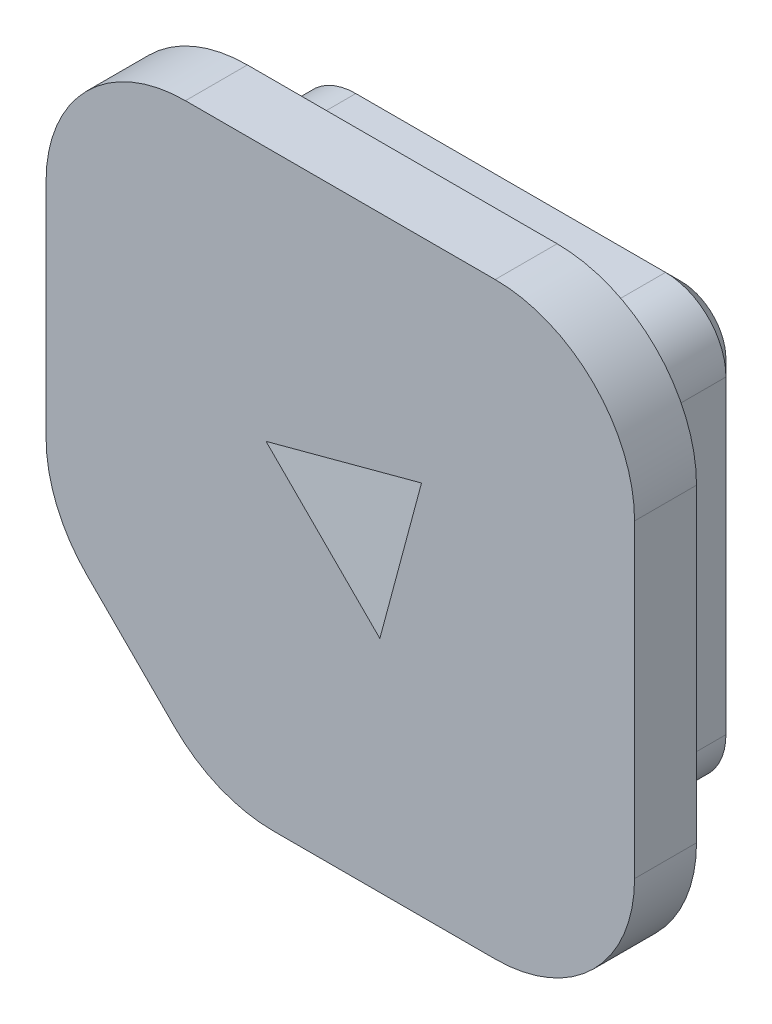
from build123d import *

# Parameters (mm, degrees)
BOSS_EXTRUDE1_DEPTH = 2
BOSS_EXTRUDE2_DEPTH = 4
CUT_EXTRUDE2_DEPTH  = 40.307216504
CHAMFER1_SIZE       = 0.5


with BuildPart() as part:
    # Sketch2 → Boss-Extrude1 (new body)
    with BuildSketch(Plane.XY):
        with BuildLine():
            Line((-26.150665133, -23.322238008), (-23.322238008, -26.150665133))
            ThreePointArc((-23.322238008, -26.150665133), (-21.862332939, -27.126142514), (-20.140257493, -27.468684618))
            Line((-20.140257493, -27.468684618), (-12.968684618, -27.468684618))
            ThreePointArc((-12.968684618, -27.468684618), (-9.786704102, -26.150665133), (-8.468684618, -22.968684618))
            Line((-8.468684618, -22.968684618), (-8.468684618, -12.968684618))
            ThreePointArc((-8.468684618, -12.968684618), (-9.786704102, -9.786704102), (-12.968684618, -8.468684618))
            Line((-12.968684618, -8.468684618), (-22.968684618, -8.468684618))
            ThreePointArc((-22.968684618, -8.468684618), (-26.150665133, -9.786704102), (-27.468684618, -12.968684618))
            Line((-27.468684618, -12.968684618), (-27.468684618, -20.140257493))
            ThreePointArc((-27.468684618, -20.140257493), (-27.126142514, -21.862332939), (-26.150665133, -23.322238008))
        make_face()
    extrude(amount=BOSS_EXTRUDE1_DEPTH)

    # Sketch1 → Boss-Extrude2 (add)
    with BuildSketch(Plane.XY):
        with BuildLine():
            Line((-12.968684618, -11.018684618), (-22.968684618, -11.018684618))
            ThreePointArc((-22.968684618, -11.018684618), (-24.347542841, -11.589826394), (-24.918684618, -12.968684618))
            Line((-24.918684618, -12.968684618), (-24.918684618, -20.140257493))
            ThreePointArc((-24.918684618, -20.140257493), (-24.770249706, -20.886490186), (-24.347542841, -21.519115716))
            Line((-24.347542841, -21.519115716), (-21.519115716, -24.347542841))
            ThreePointArc((-21.519115716, -24.347542841), (-20.886490186, -24.770249706), (-20.140257493, -24.918684618))
            Line((-20.140257493, -24.918684618), (-12.968684618, -24.918684618))
            ThreePointArc((-12.968684618, -24.918684618), (-11.589826394, -24.347542841), (-11.018684618, -22.968684618))
            Line((-11.018684618, -22.968684618), (-11.018684618, -12.968684618))
            ThreePointArc((-11.018684618, -12.968684618), (-11.589826394, -11.589826394), (-12.968684618, -11.018684618))
        make_face()
    extrude(amount=-BOSS_EXTRUDE2_DEPTH)

    # Sketch4 → Cut-Extrude2 (cut, through all)
    with BuildSketch(Plane.XY.offset(2)):
        Polygon((-16.692227482, -20.366462097), (-15.347364274, -15.347364274), (-20.366462097, -16.692227482), align=None)
    extrude(amount=-CUT_EXTRUDE2_DEPTH, mode=Mode.SUBTRACT)

    # Chamfer1
    chamfer1_edges = [part.edges().sort_by_distance(p)[0] for p in [
        (-24.770249706, -20.886490186, -4),
        (-22.933329279, -22.933329279, -4),
        (-24.918684618, -16.554471055, -4),
        (-20.886490186, -24.770249706, -4),
        (-24.347542841, -11.589826394, -4),
        (-16.554471055, -24.918684618, -4),
        (-17.968684618, -11.018684618, -4),
        (-11.589826394, -24.347542841, -4),
        (-11.589826394, -11.589826394, -4),
        (-11.018684618, -17.968684618, -4),
        (-16.019795878, -17.856913185, -4),
        (-18.529344789, -18.529344789, -4),
        (-17.856913185, -16.019795878, -4),
    ]]
    chamfer(chamfer1_edges, length=CHAMFER1_SIZE)


solid = part.part
